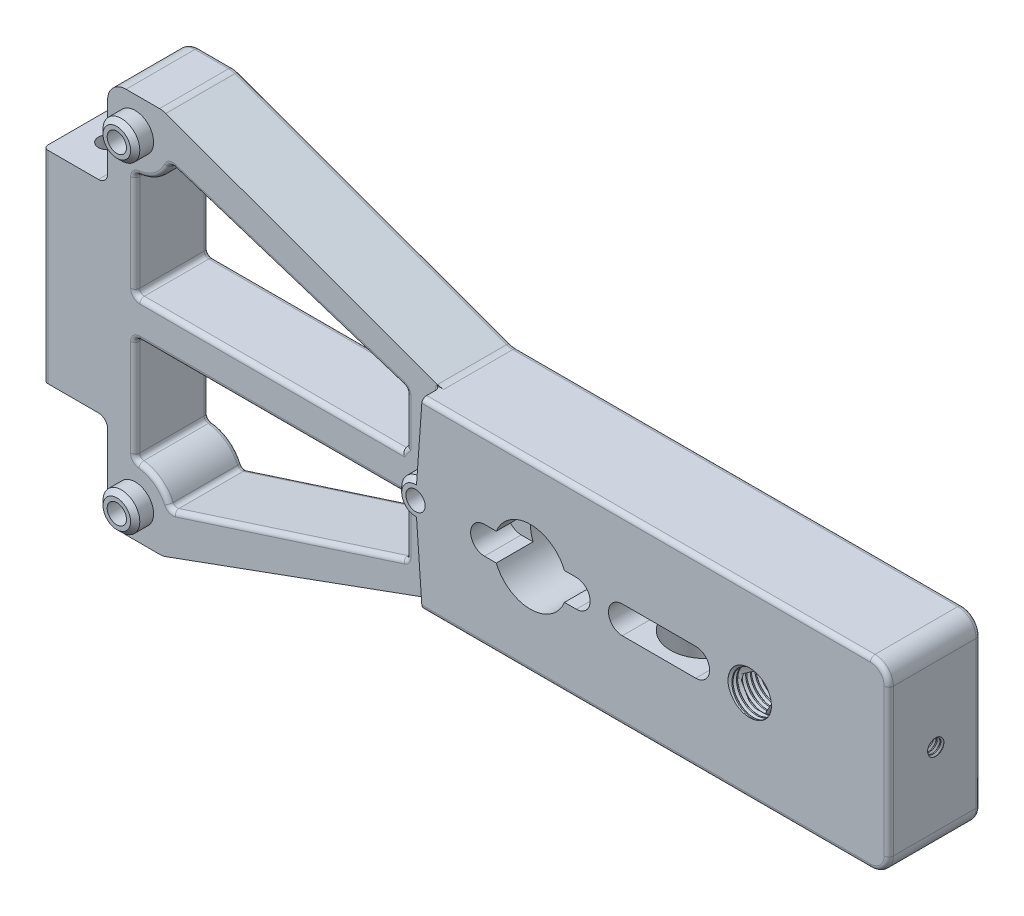
from build123d import *

# Parameters (mm, degrees)
SKETCH1_R           = 2.5
SKETCH1_R_2         = 2
SKETCH1_R_3         = 1.05
BOSS_EXTRUDE1_DEPTH = 10
SKETCH1_3_R         = 2
BOSS_EXTRUDE2_DEPTH = 8
SKETCH1_4_R         = 2
SKETCH1_4_R_2       = 1.05
BOSS_EXTRUDE3_DEPTH = 10
SKETCH2_R           = 1
CUT_EXTRUDE1_DEPTH  = 42
SKETCH3_R           = 3.75
CUT_EXTRUDE2_DEPTH  = 13
SKETCH5_R           = 4
CUT_EXTRUDE3_DEPTH  = 10
CUT_EXTRUDE4_DEPTH  = 4
CUT_EXTRUDE5_DEPTH  = 6.25
SKETCH12_W          = 7
SKETCH12_H          = 8
CUT_EXTRUDE11_DEPTH = 10
CHAMFER1_SIZE       = 0.5
FILLET1_R           = 2
FILLET2_R           = 0.5
FILLET5_R           = 0.5
CUT_EXTRUDE6_DEPTH  = 8
FILLET3_R           = 0.5
SKETCH7_R           = 2
CUT_EXTRUDE7_DEPTH  = 3
THREAD1_PITCH       = 0.5
THREAD1_FROM        = 1
THREAD1_TO          = 11
SKETCH11_R          = 1
CUT_EXTRUDE10_DEPTH = 10
THREAD4_PITCH       = 0.4
THREAD4_FROM        = 1
FILLET6_R           = 1


with BuildPart() as part:
    # Sketch1 → Boss-Extrude1 (new body)
    # profile 1 of 2: a face of its own
    with BuildSketch(Plane.XY):
        with BuildLine():
            Line((52, 10), (1.222251614, 10))
            Line((1.222251614, 10), (0.64407503, 1.994803846))
            ThreePointArc((0.64407503, 1.994803846), (1.964266038, 1.362323372), (2.5, 0))
            ThreePointArc((2.5, 0), (1.964266038, -1.362323372), (0.64407503, -1.994803846))
            Line((0.64407503, -1.994803846), (1.222251614, -10))
            Line((1.222251614, -10), (52, -10))
            Line((52, -10), (52, 10))
        make_face()
        with Locations((37, 0)):
            Circle(SKETCH1_R, mode=Mode.SUBTRACT)
    # profile 2 of 2: a face of its own
    with BuildSketch(Plane.XY):
        with Locations((0.5, 0)):
            Circle(SKETCH1_R_2)
        with Locations((0.5, 0)):
            Circle(SKETCH1_R_3, mode=Mode.SUBTRACT)
    extrude(amount=BOSS_EXTRUDE1_DEPTH)

    # Sketch1<3> → Boss-Extrude2 (add)
    with BuildSketch(Plane.XY):
        with BuildLine():
            Line((-29, 21), (-42, 21))
            Line((-42, 21), (-42, -21))
            Line((-42, -21), (-29, -21))
            Line((-29, -21), (1.222251614, -10))
            Line((1.222251614, -10), (0.64407503, -1.994803846))
            ThreePointArc((0.64407503, -1.994803846), (-1.5, 0), (0.64407503, 1.994803846))
            Line((0.64407503, 1.994803846), (1.222251614, 10))
            Line((1.222251614, 10), (-29, 21))
        make_face()
        with Locations((-32, -17.5)):
            Circle(SKETCH1_3_R, mode=Mode.SUBTRACT)
        with Locations((-32, 17.5)):
            Circle(SKETCH1_3_R, mode=Mode.SUBTRACT)
    extrude(amount=BOSS_EXTRUDE2_DEPTH)

    # Sketch1<4> → Boss-Extrude3 (add)
    # profile 1 of 2: a face of its own
    with BuildSketch(Plane.XY):
        with Locations((-32, 17.5)):
            Circle(SKETCH1_4_R)
        with Locations((-32, 17.5)):
            Circle(SKETCH1_4_R_2, mode=Mode.SUBTRACT)
    # profile 2 of 2: a face of its own
    with BuildSketch(Plane.XY):
        with Locations((-32, -17.5)):
            Circle(SKETCH1_4_R)
        with Locations((-32, -17.5)):
            Circle(SKETCH1_4_R_2, mode=Mode.SUBTRACT)
    extrude(amount=BOSS_EXTRUDE3_DEPTH)

    # Sketch2 → Cut-Extrude1 (cut)
    with BuildSketch(Plane.XZ.offset(21)):
        with Locations((-39, 4)):
            Circle(SKETCH2_R)
    extrude(amount=-CUT_EXTRUDE1_DEPTH, mode=Mode.SUBTRACT)

    # Sketch3 → Cut-Extrude2 (cut)
    with BuildSketch(Plane.XZ.offset(10)):
        with Locations(Location((27, 5, 0), (0, 0, 270))):
            Circle(SKETCH3_R)
    extrude(amount=-CUT_EXTRUDE2_DEPTH, mode=Mode.SUBTRACT)

    # Sketch5 → Cut-Extrude3 (cut)
    with BuildSketch(Plane.XY.offset(10)):
        with Locations((13, 0)):
            Circle(SKETCH5_R)
    extrude(amount=-CUT_EXTRUDE3_DEPTH, mode=Mode.SUBTRACT)

    # Sketch5<3> → Cut-Extrude4 (cut)
    with BuildSketch(Plane.XY.offset(10)):
        with BuildLine():
            Line((8, 1.5), (18, 1.5))
            ThreePointArc((18, 1.5), (19.5, 0), (18, -1.5))
            Line((18, -1.5), (8, -1.5))
            ThreePointArc((8, -1.5), (6.5, 0), (8, 1.5))
        make_face()
    extrude(amount=-CUT_EXTRUDE4_DEPTH, mode=Mode.SUBTRACT)

    # Sketch4 → Cut-Extrude5 (cut)
    with BuildSketch(Plane.XY.offset(10)):
        with BuildLine():
            Line((23, 1.5), (31, 1.5))
            ThreePointArc((31, 1.5), (32.5, 0), (31, -1.5))
            Line((31, -1.5), (23, -1.5))
            ThreePointArc((23, -1.5), (21.5, 0), (23, 1.5))
        make_face()
    extrude(amount=-CUT_EXTRUDE5_DEPTH, mode=Mode.SUBTRACT)

    # Sketch12 → Cut-Extrude11 (cut)
    with BuildSketch(Plane.XZ.offset(21)):
        with Locations((-38.5, 4)):
            Rectangle(SKETCH12_W, SKETCH12_H)
    cut_extrude11 = extrude(amount=-CUT_EXTRUDE11_DEPTH, mode=Mode.SUBTRACT)

    # Mirror1: Cut-Extrude11 across plane
    add(cut_extrude11.mirror(Plane.ZX), mode=Mode.SUBTRACT)

    # Chamfer1
    chamfer1_edges = [part.edges().sort_by_distance(p)[0] for p in [
        (-1.5, 0, 10),
        (-34, 17.5, 10),
        (-34, -17.5, 10),
    ]]
    chamfer(chamfer1_edges, length=CHAMFER1_SIZE)

    # Fillet1
    fillet1_edges = [part.edges().sort_by_distance(p)[0] for p in [
        (-35, -21, 4),
        (-35, 21, 4),
        (52, 10, 5),
        (52, -10, 5),
        (1.222251614, 10, 4),
        (-29, 21, 4),
        (-29, -21, 4),
        (1.222251614, -10, 4),
    ]]
    fillet(fillet1_edges, radius=FILLET1_R)

    # Fillet2
    fillet2_edges = [part.edges().sort_by_distance(p)[0] for p in [
        (-35, -15, 0),
        (-42, 0, 8),
        (-35, 15, 0),
        (-31.176326981, 21, 0),
        (-13.888874193, 15.5, 0),
        (25.787452788, 10, 0),
        (52, 0, 0),
        (25.787452788, -10, 0),
        (-13.888874193, -15.5, 0),
        (-31.176326981, -21, 0),
        (-29.005357606, 20.969615506, 0),
        (-29.005357606, -20.969615506, 0),
        (51.414213562, 9.414213562, 0),
        (51.414213562, -9.414213562, 0),
        (-34.414213562, -20.414213562, 0),
        (-34.414213562, 20.414213562, 0),
        (52, 0, 10),
        (51.414213562, 9.414213562, 10),
        (51.414213562, -9.414213562, 10),
        (1.22760922, 10.030384494, 0),
        (1.22760922, -10.030384494, 0),
        (25.611125807, -10, 10),
        (25.611125807, 10, 10),
    ]]
    fillet(fillet2_edges, radius=FILLET2_R)

    # Fillet5
    fillet5_edges = [part.edges().sort_by_distance(p)[0] for p in [
        (0.933163322, 5.997401923, 8),
        (0.933163322, -5.997401923, 8),
    ]]
    fillet(fillet5_edges, radius=FILLET5_R)

    # Sketch6 → Cut-Extrude6 (cut)
    with BuildSketch(Plane.XY.offset(8)):
        with BuildLine():
            ThreePointArc((-28.192557769, 16.273874536), (-29.644633984, 14.267005888), (-32, 13.5))
            Line((-32, 13.5), (-32, 2))
            Line((-32, 2), (-2.964101615, 2))
            ThreePointArc((-2.964101615, 2), (-2.748138099, 2.334437596), (-2.5, 2.645751311))
            Line((-2.5, 2.645751311), (-2.5, 8))
            Line((-2.5, 8), (-28.192557769, 16.273874536))
        make_face()
        with BuildLine():
            Line((-2.964101615, -2), (-32, -2))
            Line((-32, -2), (-32, -13.5))
            ThreePointArc((-32, -13.5), (-29.644633984, -14.267005888), (-28.192557769, -16.273874536))
            Line((-28.192557769, -16.273874536), (-2.5, -8))
            Line((-2.5, -8), (-2.5, -2.645751311))
            ThreePointArc((-2.5, -2.645751311), (-2.748138099, -2.334437596), (-2.964101615, -2))
        make_face()
    extrude(amount=-CUT_EXTRUDE6_DEPTH, mode=Mode.SUBTRACT)

    # Fillet3
    fillet3_edges = [part.edges().sort_by_distance(p)[0] for p in [
        (-32, 7.75, 8),
        (-17.482050808, 2, 8),
        (-2.5, 5.322875656, 0),
        (-2.5, 8, 4),
        (-2.5, 5.322875656, 8),
        (-15.346278884, 12.136937268, 0),
        (-28.192557769, 16.273874536, 4),
        (-15.346278884, 12.136937268, 8),
        (-29.644633984, 14.267005888, 0),
        (-32, 13.5, 4),
        (-29.644633984, 14.267005888, 8),
        (-32, 2, 4),
        (-2.748138099, 2.334437596, 0),
        (-2.748138099, 2.334437596, 8),
        (-17.482050808, 2, 0),
        (-32, 7.75, 0),
        (-32, -7.75, 8),
        (-15.346278884, -12.136937268, 8),
        (-17.482050808, -2, 0),
        (-32, -2, 4),
        (-17.482050808, -2, 8),
        (-32, -13.5, 4),
        (-29.644633984, -14.267005888, 0),
        (-28.192557769, -16.273874536, 4),
        (-29.644633984, -14.267005888, 8),
        (-2.5, -8, 4),
        (-2.5, -5.322875656, 0),
        (-2.5, -5.322875656, 8),
        (-2.748138099, -2.334437596, 0),
        (-2.964101615, -2, 4),
        (-2.748138099, -2.334437596, 8),
        (-15.346278884, -12.136937268, 0),
        (-32, -7.75, 0),
    ]]
    fillet(fillet3_edges, radius=FILLET3_R)

    # Sketch7 → Cut-Extrude7 (cut)
    with BuildSketch(Plane(origin=(0, 0, 0), x_dir=(-1, 0, 0), z_dir=(0, 0, -1))):
        with Locations(Location((32, 17.5, 0), (0, 0, 180))):
            Circle(SKETCH7_R)
        with Locations(Location((32, -17.5, 0), (0, 0, 180))):
            Circle(SKETCH7_R)
        with Locations((-0.5, 0)):
            Circle(SKETCH7_R)
    extrude(amount=-CUT_EXTRUDE7_DEPTH, mode=Mode.SUBTRACT)

    # Thread1: arcs per turn and ends read off the stored shape
    # Thread1: the profile of Thread Profile1 profile screwed along a right-hand helix through 24 turns, 6 arcs to a turn; built about Z, then put on its axis
    thread1_z = Axis((0, 0, 0), (0, 0, 1))
    thread1_corners = [(2.5003, 0, -0.000173205), (2.5003, 0, 0.43694235), (2.23, 0, 0.280884573), (2.23, 0, 0.155884573)]
    with BuildLine(mode=Mode.PRIVATE) as thread1_profile:
        Line(thread1_corners[0], thread1_corners[1])
        Line(thread1_corners[1], thread1_corners[2])
        Line(thread1_corners[2], thread1_corners[3])
        Line(thread1_corners[3], thread1_corners[0])
    thread1_cap = Face(thread1_profile.wire())
    thread1_turn_angles = [0, 30, 60, 90, 120, 150, 180, 210, 240, 270, 300, 330, 360]
    thread1_turn_weights = [1, 0.8660254037844387, 1, 0.8660254037844387, 1, 0.8660254037844387, 1, 0.8660254037844387, 1, 0.8660254037844387, 1, 0.8660254037844387, 1]
    thread1_turn_rails = [Edge.make_bspline([Vector(p[0], p[1], 0).rotate(thread1_z, thread1_turn_angles[k]) / thread1_turn_weights[k] + Vector(0, 0, p[2] + THREAD1_PITCH * thread1_turn_angles[k] / 360) for k in range(13)], [0, 0, 0, 1, 1, 2, 2, 3, 3, 4, 4, 5, 5, 6, 6, 6], 2, thread1_turn_weights) for p in thread1_corners]
    thread1_turn_sides = [Face.make_surface_from_curves(thread1_turn_rails[p[0]], thread1_turn_rails[p[1]]) for p in [(0, 1), (1, 2), (2, 3), (3, 0)]]
    thread1 = Plane(origin=(37, 0, 11), x_dir=(-1, 0, 0), z_dir=(0, 0, -1)) * split(split(Solid(Shell([*[p.moved(Location((0, 0, THREAD1_PITCH * i))) for i in range(24) for p in thread1_turn_sides], thread1_cap, thread1_cap.rotate(thread1_z, 8640).moved(Location((0, 0, THREAD1_PITCH * 8640 / 360)))])), bisect_by=Plane.XY.offset(THREAD1_FROM), keep=Keep.TOP, mode=Mode.PRIVATE), bisect_by=Plane.XY.offset(THREAD1_TO), keep=Keep.BOTTOM, mode=Mode.PRIVATE)
    add(thread1)

    # Sketch11 → Cut-Extrude10 (cut)
    with BuildSketch(Plane(origin=(52, 0, 0), x_dir=(0, 0, -1), z_dir=(1, 0, 0))):
        with Locations((-5, 0)):
            Circle(SKETCH11_R)
    extrude(amount=-CUT_EXTRUDE10_DEPTH, mode=Mode.SUBTRACT)

    # Thread4: arcs per turn and ends read off the stored shape
    # Thread4: the profile of Thread Profile4 profile screwed along a right-hand helix through 30 turns, 6 arcs to a turn; built about Z, then put on its axis
    thread4_z = Axis((0, 0, 0), (0, 0, 1))
    thread4_corners = [(1.0003, 0, -0.000173205), (1.0003, 0, 0.350173204), (0.78349365, 0, 0.224999999), (0.78349365, 0, 0.124999999)]
    with BuildLine(mode=Mode.PRIVATE) as thread4_profile:
        Line(thread4_corners[0], thread4_corners[1])
        Line(thread4_corners[1], thread4_corners[2])
        Line(thread4_corners[2], thread4_corners[3])
        Line(thread4_corners[3], thread4_corners[0])
    thread4_cap = Face(thread4_profile.wire())
    thread4_turn_angles = [0, 30, 60, 90, 120, 150, 180, 210, 240, 270, 300, 330, 360]
    thread4_turn_weights = [1, 0.8660254037844387, 1, 0.8660254037844387, 1, 0.8660254037844387, 1, 0.8660254037844387, 1, 0.8660254037844387, 1, 0.8660254037844387, 1]
    thread4_turn_rails = [Edge.make_bspline([Vector(p[0], p[1], 0).rotate(thread4_z, thread4_turn_angles[k]) / thread4_turn_weights[k] + Vector(0, 0, p[2] + THREAD4_PITCH * thread4_turn_angles[k] / 360) for k in range(13)], [0, 0, 0, 1, 1, 2, 2, 3, 3, 4, 4, 5, 5, 6, 6, 6], 2, thread4_turn_weights) for p in thread4_corners]
    thread4_turn_sides = [Face.make_surface_from_curves(thread4_turn_rails[p[0]], thread4_turn_rails[p[1]]) for p in [(0, 1), (1, 2), (2, 3), (3, 0)]]
    thread4 = Plane(origin=(53, 0, 5), x_dir=(0, 0, 1), z_dir=(-1, 0, 0)) * split(Solid(Shell([*[p.moved(Location((0, 0, THREAD4_PITCH * i))) for i in range(30) for p in thread4_turn_sides], thread4_cap, thread4_cap.rotate(thread4_z, 10800).moved(Location((0, 0, THREAD4_PITCH * 10800 / 360)))])), bisect_by=Plane.XY.offset(THREAD4_FROM), keep=Keep.TOP, mode=Mode.PRIVATE)
    add(thread4)

    # Fillet6
    # the kernel refuses this fillet: 1 mm, written as the material it adds along each edge
    with BuildSketch(Plane(origin=(-35, 11, 8), x_dir=(0, 1, 0), z_dir=(0, 0, -1))) as fillet6_piece_1:
        with BuildLine():
            CenterArc((FILLET6_R, -FILLET6_R), FILLET6_R, 90, 90)
            Line((0, -FILLET6_R), (0, 0))
            Line((0, 0), (FILLET6_R, 0))
        make_face()
    extrude(amount=7.5)
    with BuildSketch(Plane(origin=(-35, -11, 8), x_dir=(0, -1, 0), z_dir=(0, 0, -1))) as fillet6_piece_2:
        with BuildLine():
            CenterArc((FILLET6_R, FILLET6_R), FILLET6_R, 180, 90)
            Line((0, FILLET6_R), (0, 0))
            Line((0, 0), (FILLET6_R, 0))
        make_face()
    extrude(amount=7.5)
    with BuildSketch(Plane(origin=(-34.5, 11, 0.5), x_dir=(-0.9999802608561372, 0, 0.006283143965558645), z_dir=(-0.006283143965558645, 0, -0.9999802608561372))) as fillet6_piece_3_section:
        with BuildLine():
            CenterArc((0.5 + FILLET6_R, FILLET6_R), FILLET6_R, 180, 90)
            Line((0.5, FILLET6_R), (0.5, 0))
            Line((0.5, 0), (0.5 + FILLET6_R, 0))
        make_face()
    fillet6_piece_3 = revolve(axis=Axis((-34.5, 11, 0.5), (0, 1, 0)), revolution_arc=359.64, mode=Mode.PRIVATE)
    fillet6_piece_3 = split(fillet6_piece_3, bisect_by=Plane(origin=(-34.5, 11, 0), z_dir=(0, 0, 1)), keep=Keep.TOP, mode=Mode.PRIVATE)
    add(fillet6_piece_3)
    with BuildSketch(Plane(origin=(-34.5, -11, 0.5), x_dir=(-0.9999802608561372, 0, 0.006283143965558645), z_dir=(-0.006283143965558645, 0, -0.9999802608561372))) as fillet6_piece_4_section:
        with BuildLine():
            CenterArc((0.5 + FILLET6_R, -FILLET6_R), FILLET6_R, 90, 90)
            Line((0.5, -FILLET6_R), (0.5, 0))
            Line((0.5, 0), (0.5 + FILLET6_R, 0))
        make_face()
    fillet6_piece_4 = revolve(axis=Axis((-34.5, -11, 0.5), (0, 1, 0)), revolution_arc=359.64, mode=Mode.PRIVATE)
    fillet6_piece_4 = split(fillet6_piece_4, bisect_by=Plane(origin=(-34.5, -11, 0), z_dir=(0, 0, 1)), keep=Keep.TOP, mode=Mode.PRIVATE)
    add(fillet6_piece_4)


solid = part.part
